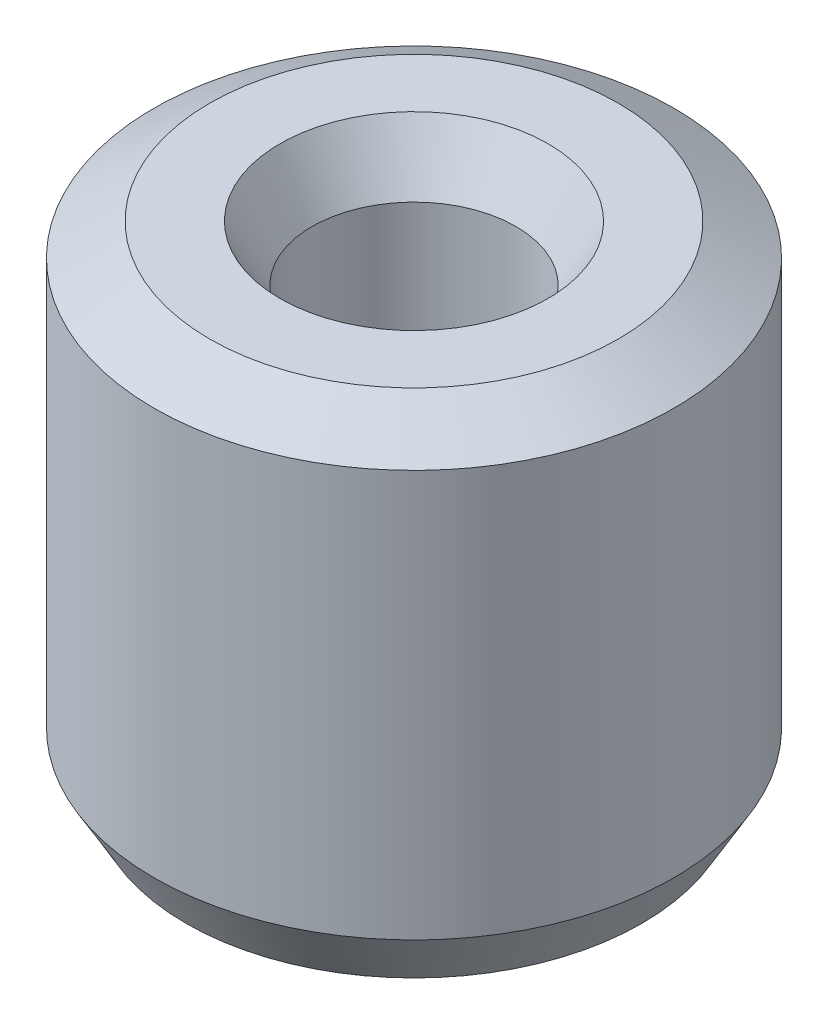
from build123d import *
from OCP.BRepFilletAPI import BRepFilletAPI_MakeChamfer

# Parameters (mm, degrees)
SKETCH1_R           = 12.5
BOSS_EXTRUDE1_DEPTH = 23.776350455
SKETCH2_R           = 4.903744608
CUT_EXTRUDE1_DEPTH  = 30.627940207
CHAMFER1_SIZE       = 1.544333961
CHAMFER1_SIZE2      = 2.674864885


with BuildPart() as part:
    # Sketch1 → Boss-Extrude1 (new body)
    with BuildSketch(Plane(origin=(0, 0, 0), x_dir=(1, 0, 0), z_dir=(0, 1, 0))):
        Circle(SKETCH1_R)
    extrude(amount=BOSS_EXTRUDE1_DEPTH)

    # Sketch2 → Cut-Extrude1 (cut, through all)
    with BuildSketch(Plane(origin=(0, 0, 0), x_dir=(1, 0, 0), z_dir=(0, 1, 0))):
        Circle(SKETCH2_R)
    extrude(amount=CUT_EXTRUDE1_DEPTH, mode=Mode.SUBTRACT)

    # Chamfer1: one chamfer whose edges measure the first distance from different faces: ONE call of the kernel's chamfer builder (chamfer() names one face for all edges)
    chamfer1_edges_1 = [part.edges().sort_by_distance(p)[0] for p in [
        (-4.903744608, 23.776350455, 0),
    ]]
    chamfer1_side_1 = [part.faces().sort_by_distance(p)[0] for p in [
        (-12.146446609, 23.776350455, 0),
    ]]
    chamfer1_edges_2 = [part.edges().sort_by_distance(p)[0] for p in [
        (-4.903744608, 0, 0),
    ]]
    chamfer1_side_2 = [part.faces().sort_by_distance(p)[0] for p in [
        (-4.903744608, 11.888175227, 0),
    ]]
    chamfer1_edges_3 = [part.edges().sort_by_distance(p)[0] for p in [
        (-12.5, 0, 0),
    ]]
    chamfer1_side_3 = [part.faces().sort_by_distance(p)[0] for p in [
        (-12.146446609, 0, 0),
    ]]
    chamfer1_edges_4 = [part.edges().sort_by_distance(p)[0] for p in [
        (-12.5, 23.776350455, 0),
    ]]
    chamfer1_side_4 = [part.faces().sort_by_distance(p)[0] for p in [
        (-12.5, 11.888175227, 0),
    ]]
    chamfer1 = BRepFilletAPI_MakeChamfer(part.part.solid().wrapped)
    for e in chamfer1_edges_1:
        chamfer1.Add(CHAMFER1_SIZE, CHAMFER1_SIZE2, e.wrapped, chamfer1_side_1[0].wrapped)  # the first distance lies on this face
    for e in chamfer1_edges_2:
        chamfer1.Add(CHAMFER1_SIZE, CHAMFER1_SIZE2, e.wrapped, chamfer1_side_2[0].wrapped)  # the first distance lies on this face
    for e in chamfer1_edges_3:
        chamfer1.Add(CHAMFER1_SIZE, CHAMFER1_SIZE2, e.wrapped, chamfer1_side_3[0].wrapped)  # the first distance lies on this face
    for e in chamfer1_edges_4:
        chamfer1.Add(CHAMFER1_SIZE, CHAMFER1_SIZE2, e.wrapped, chamfer1_side_4[0].wrapped)  # the first distance lies on this face
    add(Compound.cast(chamfer1.Shape()), mode=Mode.REPLACE)


solid = part.part
